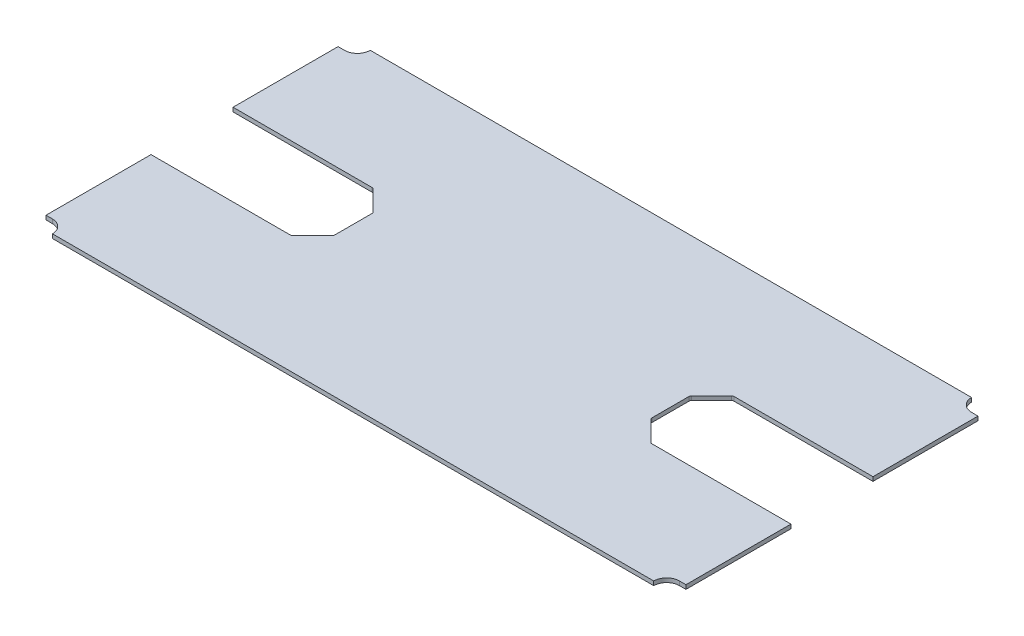
from build123d import *

# Parameters (mm, degrees)
BOSS_EXTRUDE1_DEPTH = 9.525
CHAMFER1_SIZE       = 50
FILLET2_R           = 5


with BuildPart() as part:
    # Sketch1 → Boss-Extrude1 (new body)
    with BuildSketch(Plane(origin=(0, 0, 0), x_dir=(1, 0, 0), z_dir=(0, 1, 0))):
        with BuildLine():
            Line((-745, 340), (-745, 95.5))
            Line((-745, 95.5), (-369, 95.5))
            Line((-369, 95.5), (-369, -95.5))
            Line((-369, -95.5), (-745, -95.5))
            Line((-745, -95.5), (-745, -340))
            Line((-745, -340), (-730, -340))
            ThreePointArc((-730, -340), (-708.786796564, -348.786796564), (-700, -370))
            Line((-700, -370), (700, -370))
            ThreePointArc((700, -370), (708.786796564, -348.786796564), (730, -340))
            Line((730, -340), (745, -340))
            Line((745, -340), (745, -95.5))
            Line((745, -95.5), (369, -95.5))
            Line((369, -95.5), (369, 95.5))
            Line((369, 95.5), (745, 95.5))
            Line((745, 95.5), (745, 340))
            Line((745, 340), (730, 340))
            ThreePointArc((730, 340), (708.786796564, 348.786796564), (700, 370))
            Line((700, 370), (-700, 370))
            ThreePointArc((-700, 370), (-708.786796564, 348.786796564), (-730, 340))
            Line((-730, 340), (-745, 340))
        make_face()
    extrude(amount=BOSS_EXTRUDE1_DEPTH)

    # Chamfer1
    chamfer1_edges = [part.edges().sort_by_distance(p)[0] for p in [
        (369, 4.7625, 95.5),
        (369, 4.7625, -95.5),
        (-369, 4.7625, 95.5),
        (-369, 4.7625, -95.5),
    ]]
    chamfer(chamfer1_edges, length=CHAMFER1_SIZE)

    # Fillet2
    fillet2_edges = [part.edges().sort_by_distance(p)[0] for p in [
        (369, 4.7625, -45.5),
        (369, 4.7625, 45.5),
        (419, 4.7625, 95.5),
        (419, 4.7625, -95.5),
        (-419, 4.7625, 95.5),
        (-369, 4.7625, 45.5),
        (-369, 4.7625, -45.5),
        (-419, 4.7625, -95.5),
    ]]
    fillet(fillet2_edges, radius=FILLET2_R)


solid = part.part
